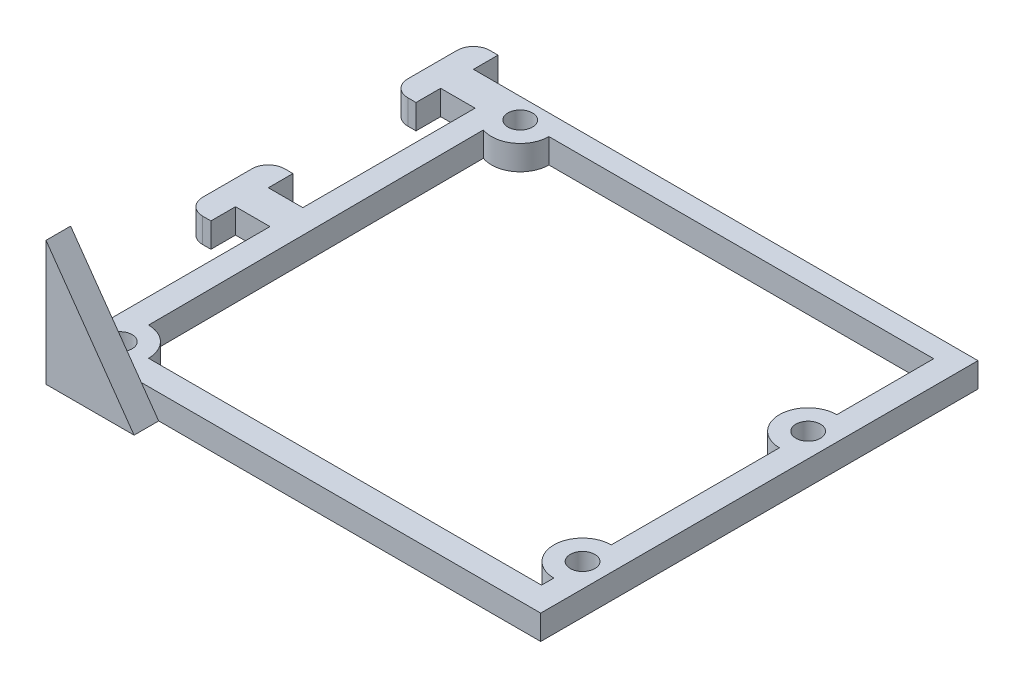
from build123d import *

# Parameters (mm, degrees)
SKETCH1_R           = 1.5
BOSS_EXTRUDE1_DEPTH = 3
BOSS_EXTRUDE2_DEPTH = 3
LPATTERN1_COUNT     = 2
LPATTERN1_PITCH     = 25
BOSS_EXTRUDE3_DEPTH = 3


with BuildPart() as part:
    # Sketch1 → Boss-Extrude1 (new body)
    with BuildSketch(Plane(origin=(0, 0, 0), x_dir=(1, 0, 0), z_dir=(0, 1, 0))):
        Polygon((0, 49.3), (0, 0), (57.3, 0), (57.3, 53.3), (0, 53.3), (0, 51.3), align=None)
        with Locations((3, 3)):
            Circle(SKETCH1_R, mode=Mode.SUBTRACT)
        with Locations((54.4, 8)):
            Circle(SKETCH1_R, mode=Mode.SUBTRACT)
        with BuildLine():
            ThreePointArc((6.5, 3), (5.474873734, 5.474873734), (3, 6.5))
            Line((3, 6.5), (2.8, 47.512143555))
            ThreePointArc((2.8, 47.512143555), (6.006240265, 47.93207392), (7.5, 50.8))
            Line((7.5, 50.8), (54.4, 50.8))
            Line((54.4, 50.8), (54.4, 39))
            ThreePointArc((54.4, 39), (50.9, 35.5), (54.4, 32))
            Line((54.4, 32), (54.4, 11.5))
            ThreePointArc((54.4, 11.5), (50.9, 8), (54.4, 4.5))
            Line((54.4, 4.5), (54.4, 3))
            Line((54.4, 3), (6.5, 3))
        make_face(mode=Mode.SUBTRACT)
        with Locations((4, 50.8)):
            Circle(SKETCH1_R, mode=Mode.SUBTRACT)
        with Locations((54.4, 35.5)):
            Circle(SKETCH1_R, mode=Mode.SUBTRACT)
    extrude(amount=BOSS_EXTRUDE1_DEPTH)

    # Sketch1<3> → Boss-Extrude2 (add)
    with BuildSketch(Plane(origin=(0, 0, 0), x_dir=(1, 0, 0), z_dir=(0, 1, 0))):
        with BuildLine():
            Line((-4.2, 49.3), (0, 49.3))
            Line((0, 49.3), (0, 51.3))
            Line((0, 51.3), (0, 53.3))
            Line((0, 53.3), (-4.2, 53.3))
            Line((-4.2, 53.3), (-4.2, 56.3))
            Line((-4.2, 56.3), (-5.2, 56.3))
            ThreePointArc((-5.2, 56.3), (-6.614213562, 55.714213562), (-7.2, 54.3))
            Line((-7.2, 54.3), (-7.2, 48.3))
            ThreePointArc((-7.2, 48.3), (-6.614213562, 46.885786438), (-5.2, 46.3))
            Line((-5.2, 46.3), (-4.2, 46.3))
            Line((-4.2, 46.3), (-4.2, 49.3))
        make_face()
    boss_extrude2 = extrude(amount=BOSS_EXTRUDE2_DEPTH)

    # LPattern1: Boss-Extrude2 ×2
    with Locations(*[(0, 0, i * LPATTERN1_PITCH) for i in range(1, LPATTERN1_COUNT)]):
        add(boss_extrude2)

    # Sketch2 → Boss-Extrude3 (add)
    with BuildSketch(Plane.XY):
        Polygon((0, 0), (0, 15.203282646), (10.735764429, 0), align=None)
    extrude(amount=BOSS_EXTRUDE3_DEPTH)


solid = part.part
